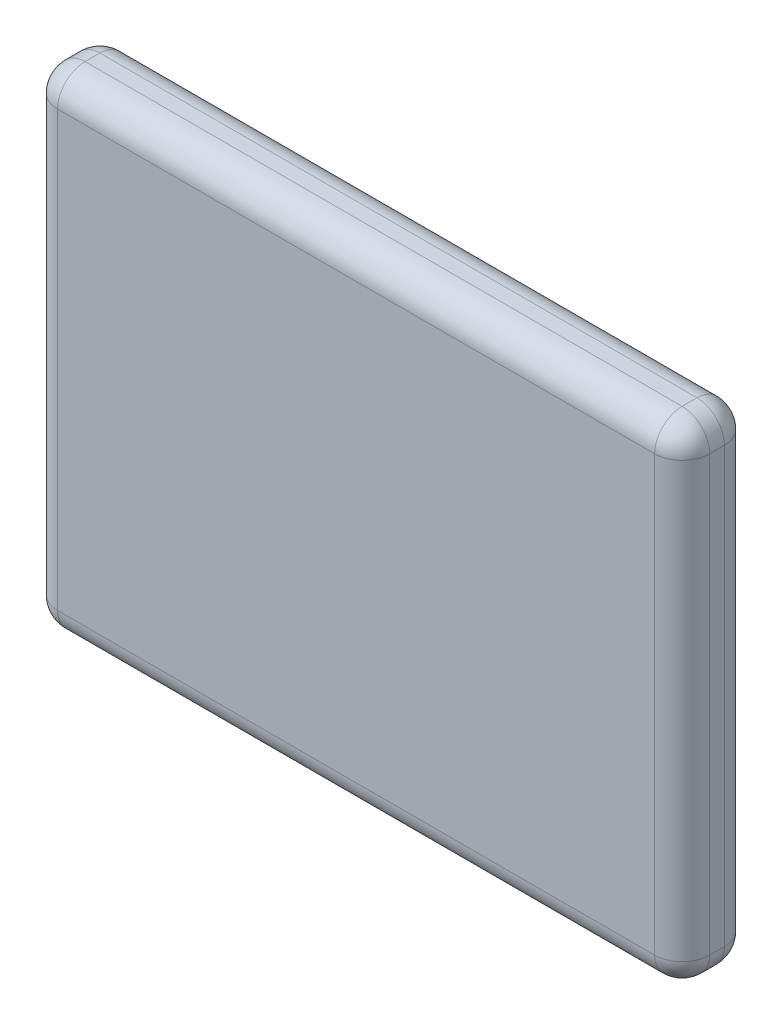
from build123d import *

# Parameters (mm, degrees)
SKETCH1_W           = 475
SKETCH1_H           = 356.34
BOSS_EXTRUDE1_DEPTH = 50.8
FILLET2_R           = 20
FILLET6_R           = 20
FILLET7_R           = 20


with BuildPart() as part:
    # Sketch1 → Boss-Extrude1 (new body)
    with BuildSketch(Plane.XY):
        with Locations((-51.338268793, -107.61191344)):
            Rectangle(SKETCH1_W, SKETCH1_H)
    extrude(amount=BOSS_EXTRUDE1_DEPTH)

    # Fillet2
    fillet2_edges = [part.edges().sort_by_distance(p)[0] for p in [
        (186.161731207, -107.61191344, 50.8),
        (-51.338268793, 70.55808656, 50.8),
        (-288.838268793, -107.61191344, 50.8),
        (-51.338268793, -285.78191344, 50.8),
    ]]
    fillet(fillet2_edges, radius=FILLET2_R)

    # Fillet6
    # the kernel refuses this fillet: 20 mm, written as the material it takes off along each edge
    with BuildSketch(Plane(origin=(166.161731207, 50.55808656, 30.8), x_dir=(1, 0, 0), z_dir=(0, 1, 0))) as fillet6_piece_1_section:
        Polygon((0, 0), (FILLET6_R * 1.02, 0), (FILLET6_R * 1.02, -FILLET6_R * 1.02), (0, -FILLET6_R * 1.02), align=None)
    fillet6_piece_1 = extrude(amount=FILLET6_R * 1.02, mode=Mode.PRIVATE)
    fillet6_piece_1 = fillet6_piece_1 - Plane(origin=(166.161731207, 50.55808656, 30.8), x_dir=(-0.7071067811865475, 0, -0.7071067811865475), z_dir=(0, 1, 0)) * Sphere(FILLET6_R, mode=Mode.PRIVATE)
    add(fillet6_piece_1, mode=Mode.SUBTRACT)
    with BuildSketch(Plane(origin=(166.161731207, -265.78191344, 30.8), x_dir=(0, -1, 0), z_dir=(1, 0, 0))) as fillet6_piece_2_section:
        Polygon((0, 0), (FILLET6_R * 1.02, 0), (FILLET6_R * 1.02, -FILLET6_R * 1.02), (0, -FILLET6_R * 1.02), align=None)
    fillet6_piece_2 = extrude(amount=FILLET6_R * 1.02, mode=Mode.PRIVATE)
    fillet6_piece_2 = fillet6_piece_2 - Plane(origin=(166.161731207, -265.78191344, 30.8), x_dir=(0, 0.7071067811865475, -0.7071067811865475), z_dir=(1, 0, 0)) * Sphere(FILLET6_R, mode=Mode.PRIVATE)
    add(fillet6_piece_2, mode=Mode.SUBTRACT)
    with BuildSketch(Plane(origin=(-268.838268793, 50.55808656, 30.8), x_dir=(-1, 0, 0), z_dir=(0, 1, 0))) as fillet6_piece_3_section:
        Polygon((0, 0), (FILLET6_R * 1.02, 0), (FILLET6_R * 1.02, FILLET6_R * 1.02), (0, FILLET6_R * 1.02), align=None)
    fillet6_piece_3 = extrude(amount=FILLET6_R * 1.02, mode=Mode.PRIVATE)
    fillet6_piece_3 = fillet6_piece_3 - Plane(origin=(-268.838268793, 50.55808656, 30.8), x_dir=(0.7071067811865475, 0, -0.7071067811865475), z_dir=(0, 1, 0)) * Sphere(FILLET6_R, mode=Mode.PRIVATE)
    add(fillet6_piece_3, mode=Mode.SUBTRACT)
    with BuildSketch(Plane(origin=(-268.838268793, -265.78191344, 30.8), x_dir=(0, -1, 0), z_dir=(-1, 0, 0))) as fillet6_piece_4_section:
        Polygon((0, 0), (FILLET6_R * 1.02, 0), (FILLET6_R * 1.02, FILLET6_R * 1.02), (0, FILLET6_R * 1.02), align=None)
    fillet6_piece_4 = extrude(amount=FILLET6_R * 1.02, mode=Mode.PRIVATE)
    fillet6_piece_4 = fillet6_piece_4 - Plane(origin=(-268.838268793, -265.78191344, 30.8), x_dir=(0, 0.7071067811865475, -0.7071067811865475), z_dir=(-1, 0, 0)) * Sphere(FILLET6_R, mode=Mode.PRIVATE)
    add(fillet6_piece_4, mode=Mode.SUBTRACT)
    with BuildSketch(Plane(origin=(-288.838268793, -285.78191344, -50), x_dir=(0, 1, 0), z_dir=(0, 0, 1)), Plane(origin=(-288.838268793, 70.55808656, -50), x_dir=(1, 0, 0), z_dir=(0, 0, 1))) as fillet6_piece_5:
        with BuildLine():
            CenterArc((FILLET6_R, -FILLET6_R), FILLET6_R, 90, 90)
            Line((0, -FILLET6_R), (0, 0))
            Line((0, 0), (FILLET6_R, 0))
        make_face()
    extrude(amount=80.8, mode=Mode.SUBTRACT)
    with BuildSketch(Plane(origin=(186.161731207, -285.78191344, -50), x_dir=(0, 1, 0), z_dir=(0, 0, 1)), Plane(origin=(186.161731207, 70.55808656, -50), x_dir=(-1, 0, 0), z_dir=(0, 0, 1))) as fillet6_piece_6:
        with BuildLine():
            CenterArc((FILLET6_R, FILLET6_R), FILLET6_R, 180, 90)
            Line((0, FILLET6_R), (0, 0))
            Line((0, 0), (FILLET6_R, 0))
        make_face()
    extrude(amount=80.8, mode=Mode.SUBTRACT)

    # Fillet7
    fillet7_edges = [part.edges().sort_by_distance(p)[0] for p in [
        (-51.338268793, 70.55808656, 0),
        (-288.838268793, -107.61191344, 0),
        (186.161731207, -107.61191344, 0),
        (-51.338268793, -285.78191344, 0),
        (-282.980404416, 64.700222184, 0),
        (-282.980404416, -279.924049063, 0),
        (180.303866831, -279.924049063, 0),
        (180.303866831, 64.700222184, 0),
    ]]
    fillet(fillet7_edges, radius=FILLET7_R)


solid = part.part
